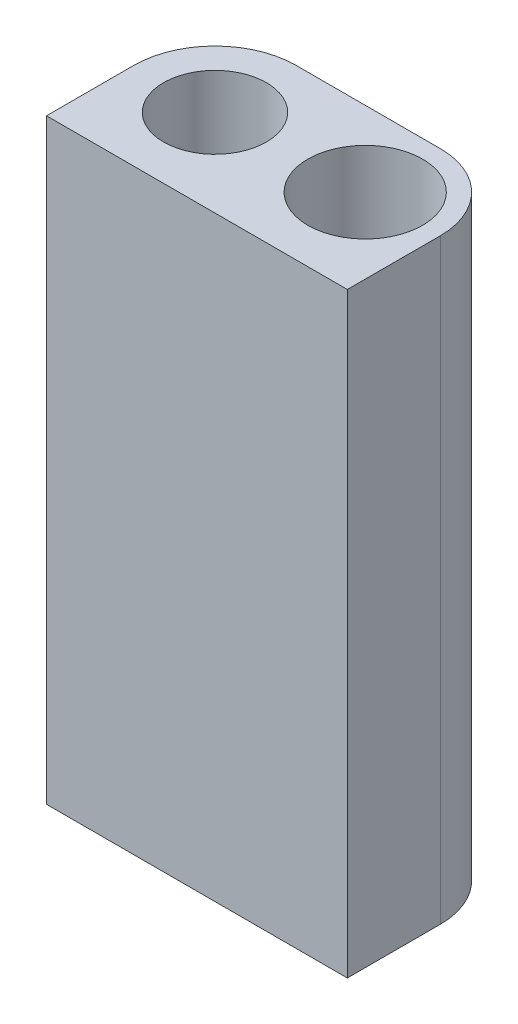
from build123d import *

# Parameters (mm, degrees)
SKETCH1_R           = 3.45
SKETCH1_R_2         = 3.85
BOSS_EXTRUDE2_DEPTH = 40


with BuildPart() as part:
    # Sketch1 → Boss-Extrude2 (new body)
    with BuildSketch(Plane(origin=(0, 0, 0), x_dir=(1, 0, 0), z_dir=(0, 1, 0))):
        with BuildLine():
            ThreePointArc((0, 5.45), (-3.853731957, 3.853731957), (-5.45, 0))
            Line((-5.45, 0), (-5.45, -5.85))
            Line((-5.45, -5.85), (14.7291644, -5.85))
            Line((14.7291644, -5.85), (14.7291644, 0.4))
            ThreePointArc((14.7291644, 0.4), (13.250053645, 3.970889245), (9.6791644, 5.45))
            Line((9.6791644, 5.45), (0, 5.45))
        make_face()
        Circle(SKETCH1_R, mode=Mode.SUBTRACT)
        with Locations((9.6791644, 0.4)):
            Circle(SKETCH1_R_2, mode=Mode.SUBTRACT)
    extrude(amount=BOSS_EXTRUDE2_DEPTH)


solid = part.part
